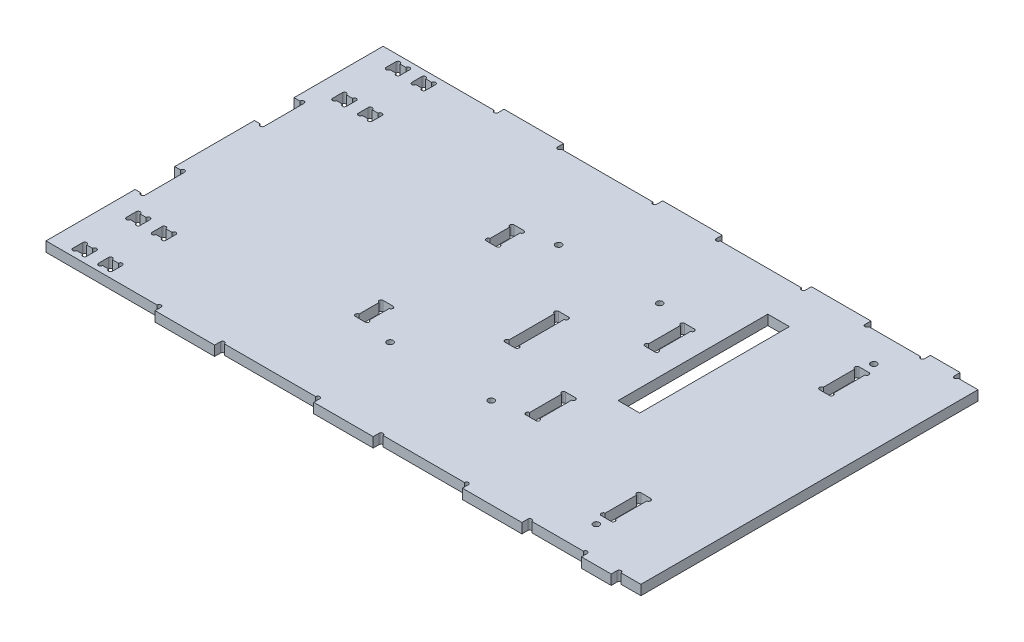
from build123d import *

# Parameters (mm, degrees)
SKETCH_1_W           = 300
SKETCH_1_H           = 170
EXTRUDE_1_DEPTH      = 5
SKETCH_2_W           = 5
SKETCH_2_H           = 27
SKETCH_2_H_2         = 20
CUT_EXTRUDE_1_DEPTH  = 10
SKETCH_3_R           = 1.55
CUT_EXTRUDE_2_DEPTH  = 10
SKETCH_4_W           = 5
SKETCH_4_H           = 20
CUT_EXTRUDE_3_DEPTH  = 5
SKETCH_5_R           = 1.05
CUT_EXTRUDE_4_DEPTH  = 10
SKETCH_8_W           = 30
SKETCH_8_H           = 3
SKETCH_8_W_2         = 15
EXTRUDE_2_DEPTH      = 5
SKETCH_9_R           = 1
CUT_EXTRUDE_6_DEPTH  = 5
SKETCH_13_W          = 7
SKETCH_13_H          = 5
CUT_EXTRUDE_9_DEPTH  = 10
SKETCH_14_R          = 1
CUT_EXTRUDE_10_DEPTH = 10
SKETCH_15_W          = 5
SKETCH_15_H          = 14
SKETCH_15_H_2        = 20
CUT_EXTRUDE_11_DEPTH = 10
SKETCH_16_R          = 1
CUT_EXTRUDE_12_DEPTH = 10
SKETCH_17_W          = 10.9
SKETCH_17_H          = 75.5
CUT_EXTRUDE_13_DEPTH = 10
SKETCH_19_W          = 5.2
SKETCH_19_H          = 11.778826781
SKETCH_19_H_2        = 11.694797023
SKETCH_19_H_3        = 17.375654454
SKETCH_19_H_4        = 17.66182615
SKETCH_19_H_5        = 17.434521592
SKETCH_19_H_6        = 17.807451512
CUT_EXTRUDE_15_DEPTH = 10


with BuildPart() as part:
    # 스케치1 → 보스-돌출1 (new body)
    with BuildSketch(Plane(origin=(0, 0, 0), x_dir=(1, 0, 0), z_dir=(0, 1, 0))):
        with Locations((150, 85)):
            Rectangle(SKETCH_1_W, SKETCH_1_H)
    extrude(amount=EXTRUDE_1_DEPTH)

    # 스케치2 → 컷-돌출1 (cut)
    with BuildSketch(Plane.XZ):
        with Locations((162.5, -85)):
            Rectangle(SKETCH_2_W, SKETCH_2_H)
        with Locations((262.5, -30)):
            Rectangle(SKETCH_2_W, SKETCH_2_H_2)
        with Locations((262.5, -140)):
            Rectangle(SKETCH_2_W, SKETCH_2_H_2)
    extrude(amount=-CUT_EXTRUDE_1_DEPTH, mode=Mode.SUBTRACT)

    # 스케치3 → 컷-돌출2 (cut)
    with BuildSketch(Plane(origin=(0, 5, 0), x_dir=(1, 0, 0), z_dir=(0, 1, 0))):
        with Locations((131, 127.5)):
            Circle(SKETCH_3_R)
        with Locations((182, 127.5)):
            Circle(SKETCH_3_R)
        with Locations((182, 42.5)):
            Circle(SKETCH_3_R)
        with Locations((131, 42.5)):
            Circle(SKETCH_3_R)
        with Locations((262.5, 155)):
            Circle(SKETCH_3_R)
        with Locations((262.5, 15)):
            Circle(SKETCH_3_R)
    extrude(amount=-CUT_EXTRUDE_2_DEPTH, mode=Mode.SUBTRACT)

    # 스케치4 → 컷-돌출3 (cut)
    with BuildSketch(Plane.XZ):
        with Locations((2.5, -115.1)):
            Rectangle(SKETCH_4_W, SKETCH_4_H)
        with Locations((2.5, -54.9)):
            Rectangle(SKETCH_4_W, SKETCH_4_H)
    extrude(amount=-CUT_EXTRUDE_3_DEPTH, mode=Mode.SUBTRACT)

    # 스케치5 → 컷-돌출4 (cut)
    with BuildSketch(Plane.XZ):
        with Locations((160, -72.55)):
            Circle(SKETCH_5_R)
        with Locations((3.95, -44.9)):
            Circle(SKETCH_5_R)
        with Locations((3.95, -64.9)):
            Circle(SKETCH_5_R)
        with Locations((165, -72.55)):
            Circle(SKETCH_5_R)
        with Locations((260, -21.05)):
            Circle(SKETCH_5_R)
        with Locations((265, -38.95)):
            Circle(SKETCH_5_R)
        with Locations((260, -38.95)):
            Circle(SKETCH_5_R)
        with Locations((265, -21.05)):
            Circle(SKETCH_5_R)
        with Locations((265, -148.95)):
            Circle(SKETCH_5_R)
        with Locations((260, -131.05)):
            Circle(SKETCH_5_R)
        with Locations((265, -131.05)):
            Circle(SKETCH_5_R)
        with Locations((260, -148.95)):
            Circle(SKETCH_5_R)
        with Locations((165, -97.45)):
            Circle(SKETCH_5_R)
        with Locations((3.95, -105.1)):
            Circle(SKETCH_5_R)
        with Locations((3.95, -125.1)):
            Circle(SKETCH_5_R)
        with Locations((160, -97.45)):
            Circle(SKETCH_5_R)
    extrude(amount=-CUT_EXTRUDE_4_DEPTH, mode=Mode.SUBTRACT)

    # 스케치8 → 보스-돌출2 (add)
    with BuildSketch(Plane.XZ):
        with Locations((73, 1.5)):
            Rectangle(SKETCH_8_W, SKETCH_8_H)
        with Locations((153, 1.5)):
            Rectangle(SKETCH_8_W, SKETCH_8_H)
        with Locations((228, 1.5)):
            Rectangle(SKETCH_8_W, SKETCH_8_H)
        with Locations((280.5, 1.5)):
            Rectangle(SKETCH_8_W_2, SKETCH_8_H)
        with Locations((280.5, -171.5)):
            Rectangle(SKETCH_8_W_2, SKETCH_8_H)
        with Locations((228, -171.5)):
            Rectangle(SKETCH_8_W, SKETCH_8_H)
        with Locations((153, -171.5)):
            Rectangle(SKETCH_8_W, SKETCH_8_H)
        with Locations((73, -171.5)):
            Rectangle(SKETCH_8_W, SKETCH_8_H)
    extrude(amount=-EXTRUDE_2_DEPTH)

    # 스케치9 → 컷-돌출6 (cut)
    with BuildSketch(Plane.XZ):
        with Locations((57, 0)):
            Circle(SKETCH_9_R)
        with Locations((89, 0)):
            Circle(SKETCH_9_R)
        with Locations((137, 0)):
            Circle(SKETCH_9_R)
        with Locations((169, 0)):
            Circle(SKETCH_9_R)
        with Locations((212, 0)):
            Circle(SKETCH_9_R)
        with Locations((272, 0)):
            Circle(SKETCH_9_R)
        with Locations((244, 0)):
            Circle(SKETCH_9_R)
        with Locations((289, 0)):
            Circle(SKETCH_9_R)
        with Locations((289, -170)):
            Circle(SKETCH_9_R)
        with Locations((244, -170)):
            Circle(SKETCH_9_R)
        with Locations((272, -170)):
            Circle(SKETCH_9_R)
        with Locations((212, -170)):
            Circle(SKETCH_9_R)
        with Locations((169, -170)):
            Circle(SKETCH_9_R)
        with Locations((137, -170)):
            Circle(SKETCH_9_R)
        with Locations((89, -170)):
            Circle(SKETCH_9_R)
        with Locations((57, -170)):
            Circle(SKETCH_9_R)
    extrude(amount=-CUT_EXTRUDE_6_DEPTH, mode=Mode.SUBTRACT)

    # 스케치13 → 컷-돌출9 (cut)
    with BuildSketch(Plane(origin=(0, 5, 0), x_dir=(1, 0, 0), z_dir=(0, 1, 0))):
        with Locations((26.5, 6.000000001)):
            Rectangle(SKETCH_13_W, SKETCH_13_H)
        with Locations((13.5, 6.000000001)):
            Rectangle(SKETCH_13_W, SKETCH_13_H)
        with Locations((13.5, 33.000000001)):
            Rectangle(SKETCH_13_W, SKETCH_13_H)
        with Locations((26.5, 33.000000001)):
            Rectangle(SKETCH_13_W, SKETCH_13_H)
        with Locations((26.5, 136.999999999)):
            Rectangle(SKETCH_13_W, SKETCH_13_H)
        with Locations((13.5, 136.999999999)):
            Rectangle(SKETCH_13_W, SKETCH_13_H)
        with Locations((13.5, 163.999999999)):
            Rectangle(SKETCH_13_W, SKETCH_13_H)
        with Locations((26.5, 163.999999999)):
            Rectangle(SKETCH_13_W, SKETCH_13_H)
    extrude(amount=-CUT_EXTRUDE_9_DEPTH, mode=Mode.SUBTRACT)

    # 스케치14 → 컷-돌출10 (cut)
    with BuildSketch(Plane.XZ):
        with Locations((11, -8.500000001)):
            Circle(SKETCH_14_R)
        with Locations((11, -3.500000001)):
            Circle(SKETCH_14_R)
        with Locations((16, -3.500000001)):
            Circle(SKETCH_14_R)
        with Locations((16, -8.500000001)):
            Circle(SKETCH_14_R)
        with Locations((24, -8.500000001)):
            Circle(SKETCH_14_R)
        with Locations((24, -3.500000001)):
            Circle(SKETCH_14_R)
        with Locations((29, -3.500000001)):
            Circle(SKETCH_14_R)
        with Locations((29, -8.500000001)):
            Circle(SKETCH_14_R)
        with Locations((29, -30.500000001)):
            Circle(SKETCH_14_R)
        with Locations((29, -35.500000001)):
            Circle(SKETCH_14_R)
        with Locations((24, -35.500000001)):
            Circle(SKETCH_14_R)
        with Locations((24, -30.500000001)):
            Circle(SKETCH_14_R)
        with Locations((16, -30.500000001)):
            Circle(SKETCH_14_R)
        with Locations((16, -35.500000001)):
            Circle(SKETCH_14_R)
        with Locations((11, -35.500000001)):
            Circle(SKETCH_14_R)
        with Locations((11, -30.500000001)):
            Circle(SKETCH_14_R)
        with Locations((11, -139.499999999)):
            Circle(SKETCH_14_R)
        with Locations((11, -134.499999999)):
            Circle(SKETCH_14_R)
        with Locations((16, -134.499999999)):
            Circle(SKETCH_14_R)
        with Locations((16, -139.499999999)):
            Circle(SKETCH_14_R)
        with Locations((24, -139.499999999)):
            Circle(SKETCH_14_R)
        with Locations((24, -134.499999999)):
            Circle(SKETCH_14_R)
        with Locations((29, -134.499999999)):
            Circle(SKETCH_14_R)
        with Locations((29, -139.499999999)):
            Circle(SKETCH_14_R)
        with Locations((29, -161.499999999)):
            Circle(SKETCH_14_R)
        with Locations((29, -166.499999999)):
            Circle(SKETCH_14_R)
        with Locations((24, -166.499999999)):
            Circle(SKETCH_14_R)
        with Locations((24, -161.499999999)):
            Circle(SKETCH_14_R)
        with Locations((16, -161.499999999)):
            Circle(SKETCH_14_R)
        with Locations((16, -166.499999999)):
            Circle(SKETCH_14_R)
        with Locations((11, -166.499999999)):
            Circle(SKETCH_14_R)
        with Locations((11, -161.499999999)):
            Circle(SKETCH_14_R)
    extrude(amount=-CUT_EXTRUDE_10_DEPTH, mode=Mode.SUBTRACT)

    # 스케치15 → 컷-돌출11 (cut)
    with BuildSketch(Plane(origin=(0, 5, 0), x_dir=(1, 0, 0), z_dir=(0, 1, 0))):
        with Locations((113.5, 118)):
            Rectangle(SKETCH_15_W, SKETCH_15_H)
        with Locations((113.5, 52)):
            Rectangle(SKETCH_15_W, SKETCH_15_H)
        with Locations((199.5, 55)):
            Rectangle(SKETCH_15_W, SKETCH_15_H_2)
        with Locations((199.5, 115)):
            Rectangle(SKETCH_15_W, SKETCH_15_H_2)
    extrude(amount=-CUT_EXTRUDE_11_DEPTH, mode=Mode.SUBTRACT)

    # 스케치16 → 컷-돌출12 (cut)
    with BuildSketch(Plane(origin=(0, 5, 0), x_dir=(1, 0, 0), z_dir=(0, 1, 0))):
        with Locations((111, 46)):
            Circle(SKETCH_16_R)
        with Locations((116, 46)):
            Circle(SKETCH_16_R)
        with Locations((116, 58)):
            Circle(SKETCH_16_R)
        with Locations((111, 58)):
            Circle(SKETCH_16_R)
        with Locations((111, 112)):
            Circle(SKETCH_16_R)
        with Locations((116, 112)):
            Circle(SKETCH_16_R)
        with Locations((116, 124)):
            Circle(SKETCH_16_R)
        with Locations((111, 124)):
            Circle(SKETCH_16_R)
        with Locations((202, 124)):
            Circle(SKETCH_16_R)
        with Locations((197, 124)):
            Circle(SKETCH_16_R)
        with Locations((197, 64)):
            Circle(SKETCH_16_R)
        with Locations((202, 64)):
            Circle(SKETCH_16_R)
        with Locations((202, 106)):
            Circle(SKETCH_16_R)
        with Locations((197, 106)):
            Circle(SKETCH_16_R)
        with Locations((197, 46)):
            Circle(SKETCH_16_R)
        with Locations((202, 46)):
            Circle(SKETCH_16_R)
    extrude(amount=-CUT_EXTRUDE_12_DEPTH, mode=Mode.SUBTRACT)

    # 스케치17 → 컷-돌출13 (cut)
    with BuildSketch(Plane(origin=(0, 5, 0), x_dir=(1, 0, 0), z_dir=(0, 1, 0))):
        with Locations((219.45, 112.25)):
            Rectangle(SKETCH_17_W, SKETCH_17_H)
    extrude(amount=-CUT_EXTRUDE_13_DEPTH, mode=Mode.SUBTRACT)

    # 스케치19 → 컷-돌출15 (cut)
    with BuildSketch(Plane(origin=(0, 5, 0), x_dir=(1, 0, 0), z_dir=(0, 1, 0))):
        with Locations((113.5, 118.024605115)):
            Rectangle(SKETCH_19_W, SKETCH_19_H)
        with Locations((113.5, 52.140636728)):
            Rectangle(SKETCH_19_W, SKETCH_19_H_2)
        with Locations((199.5, 55.305919248)):
            Rectangle(SKETCH_19_W, SKETCH_19_H_3)
        with Locations((199.5, 115.08310543)):
            Rectangle(SKETCH_19_W, SKETCH_19_H_4)
        with Locations((262.5, 29.898269496)):
            Rectangle(SKETCH_19_W, SKETCH_19_H_5)
        with Locations((262.5, 140.138454713)):
            Rectangle(SKETCH_19_W, SKETCH_19_H_6)
    extrude(amount=-CUT_EXTRUDE_15_DEPTH, mode=Mode.SUBTRACT)


solid = part.part
